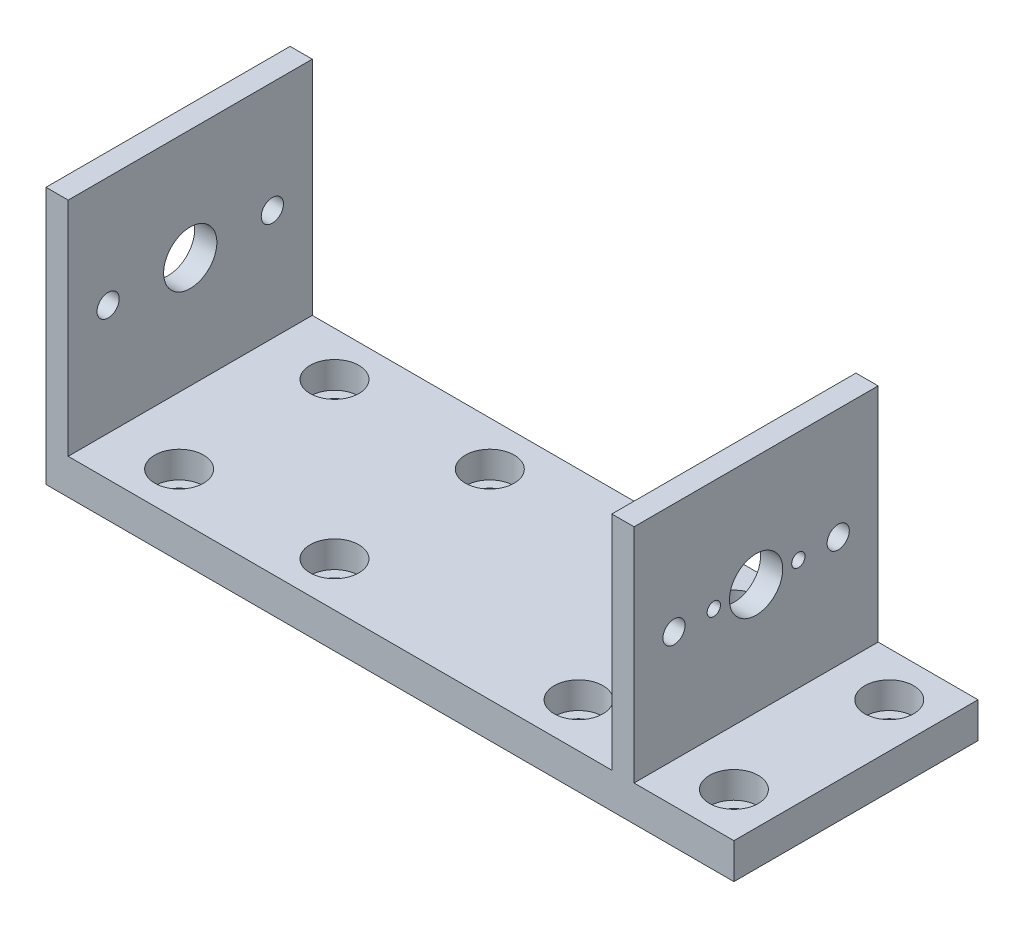
from build123d import *

# Parameters (mm, degrees)
SKETCH1_W               = 145
SKETCH1_H               = 55
SKETCH1_R               = 3.25
BOSS_EXTRUDE1_DEPTH     = 8
SKETCH5_R               = 5.5
CUT_EXTRUDE1_DEPTH      = 6
SKETCH3_W               = 55
SKETCH3_H               = 8
BOSS_EXTRUDE3_DEPTH     = 10
SKETCH4_W               = 5
SKETCH4_H               = 55
BOSS_EXTRUDE4_DEPTH     = 50
CUT_EXTRUDE2_DEPTH      = 168.765461284
CUT_EXTRUDE2_DEPTH_BACK = 168.765461284
SKETCH6_R               = 6
SKETCH6_R_2             = 2.5
SKETCH8_R               = 1.5
CUT_EXTRUDE3_DEPTH      = 10


with BuildPart() as part:
    # Sketch1 → Boss-Extrude1 (new body)
    with BuildSketch(Plane(origin=(0, 0, 0), x_dir=(1, 0, 0), z_dir=(0, 1, 0))):
        Rectangle(SKETCH1_W, SKETCH1_H)
        with Locations((-62.5, 17.5)):
            Circle(SKETCH1_R, mode=Mode.SUBTRACT)
        with Locations((-62.5, -17.5)):
            Circle(SKETCH1_R, mode=Mode.SUBTRACT)
        with Locations((-27.5, -17.5)):
            Circle(SKETCH1_R, mode=Mode.SUBTRACT)
        with Locations((-27.5, 17.5)):
            Circle(SKETCH1_R, mode=Mode.SUBTRACT)
        with Locations((62.5, -17.5)):
            Circle(SKETCH1_R, mode=Mode.SUBTRACT)
        with Locations((27.5, -17.5)):
            Circle(SKETCH1_R, mode=Mode.SUBTRACT)
        with Locations((27.5, 17.5)):
            Circle(SKETCH1_R, mode=Mode.SUBTRACT)
        with Locations((62.5, 17.5)):
            Circle(SKETCH1_R, mode=Mode.SUBTRACT)
    extrude(amount=BOSS_EXTRUDE1_DEPTH)

    # Sketch5 → Cut-Extrude1 (cut)
    with BuildSketch(Plane(origin=(0, 8, 0), x_dir=(1, 0, 0), z_dir=(0, 1, 0))):
        with Locations((-62.5, 17.5)):
            Circle(SKETCH5_R)
        with Locations((-27.5, 17.5)):
            Circle(SKETCH5_R)
        with Locations((27.5, 17.5)):
            Circle(SKETCH5_R)
        with Locations((62.5, 17.5)):
            Circle(SKETCH5_R)
        with Locations((62.5, -17.5)):
            Circle(SKETCH5_R)
        with Locations((27.5, -17.5)):
            Circle(SKETCH5_R)
        with Locations((-27.5, -17.5)):
            Circle(SKETCH5_R)
        with Locations((-62.5, -17.5)):
            Circle(SKETCH5_R)
    extrude(amount=-CUT_EXTRUDE1_DEPTH, mode=Mode.SUBTRACT)

    # Sketch3 → Boss-Extrude3 (add)
    with BuildSketch(Plane.ZY.offset(72.5)):
        with Locations((0, 4)):
            Rectangle(SKETCH3_W, SKETCH3_H)
    extrude(amount=BOSS_EXTRUDE3_DEPTH)

    # Sketch4 → Boss-Extrude4 (add)
    with BuildSketch(Plane(origin=(0, 8, 0), x_dir=(1, 0, 0), z_dir=(0, 1, 0))):
        with Locations((-80, 0)):
            Rectangle(SKETCH4_W, SKETCH4_H)
        with Locations((47.5, 0)):
            Rectangle(SKETCH4_W, SKETCH4_H)
    extrude(amount=BOSS_EXTRUDE4_DEPTH)

    # Sketch6 → Cut-Extrude2 (cut, two sides: drawn at the far end of the back side and taken through both)
    with BuildSketch(Plane.ZY.offset(82.5).offset(-CUT_EXTRUDE2_DEPTH_BACK)):
        with Locations((0, 33)):
            Circle(SKETCH6_R)
        with Locations((-18.5, 33)):
            Circle(SKETCH6_R_2)
        with Locations((18.5, 33)):
            Circle(SKETCH6_R_2)
    extrude(amount=CUT_EXTRUDE2_DEPTH + CUT_EXTRUDE2_DEPTH_BACK, mode=Mode.SUBTRACT)

    # Sketch8 → Cut-Extrude3 (cut)
    with BuildSketch(Plane(origin=(50, 0, 0), x_dir=(0, 0, -1), z_dir=(1, 0, 0))):
        with Locations((9.525, 33)):
            Circle(SKETCH8_R)
        with Locations((-9.525, 33)):
            Circle(SKETCH8_R)
    extrude(amount=-CUT_EXTRUDE3_DEPTH, mode=Mode.SUBTRACT)


solid = part.part
